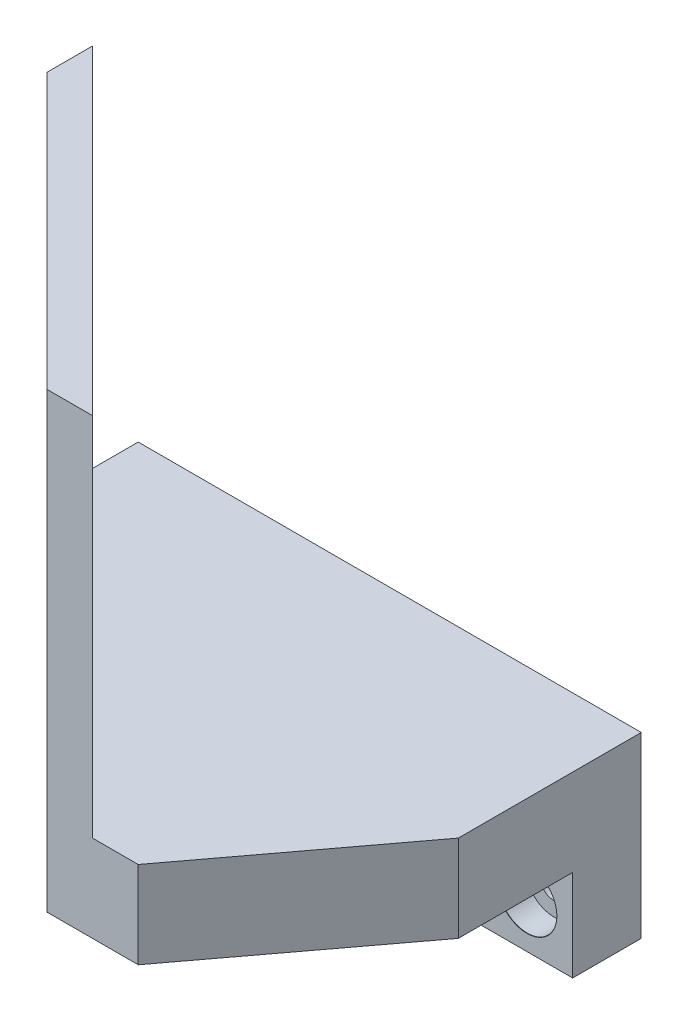
from build123d import *

# Parameters (mm, degrees)
SKETCH1_W                     = 40
SKETCH1_H                     = 10
BOSS_EXTRUDE1_DEPTH           = 7.5
CBORE_FOR_M3_SHCS1_AT_2_COUNT = 2
CBORE_FOR_M3_SHCS1_AT_2_PITCH = 30
SKETCH4_W                     = 55
SKETCH4_H                     = 9.5
BOSS_EXTRUDE2_DEPTH           = 40
BOSS_EXTRUDE3_DEPTH           = 40
CUT_EXTRUDE1_DEPTH            = 70.282032303
CUT_EXTRUDE2_DEPTH            = 70.282032303


# Read off the part's stored shape, not the designer's step: Ø5.1 (5.1) Diameter Hole1
with BuildPart() as part:
    # Sketch1 → Boss-Extrude1 (new body)
    with BuildSketch(Plane.XY):
        with Locations((20, -5)):
            Rectangle(SKETCH1_W, SKETCH1_H)
    extrude(amount=BOSS_EXTRUDE1_DEPTH)

    # Sketch3 → CBORE for M3 SHCS1 (revolve, cut)
    with BuildSketch(Plane(origin=(35, -5, 7.5), x_dir=(0, -1, 0), z_dir=(1, 0, 0))):
        Polygon((0, 0), (0, 7.5), (1.7, 7.5), (1.7, 3), (3.25, 3), (3.25, 0.025), (3.275, 0), align=None)
    cbore_for_m3_shcs1 = revolve(axis=Axis((35, -5, 13.85), (0, 0, -1)), mode=Mode.SUBTRACT)

    # CBORE for M3 SHCS1 at 2: CBORE for M3 SHCS1 ×2
    with Locations(*[(-i * CBORE_FOR_M3_SHCS1_AT_2_PITCH, 0, 0) for i in range(1, CBORE_FOR_M3_SHCS1_AT_2_COUNT)]):
        add(cbore_for_m3_shcs1, mode=Mode.SUBTRACT)

    # Sketch4 → Boss-Extrude2 (add)
    with BuildSketch(Plane.XY):
        with Locations((12.5, 4.75)):
            Rectangle(SKETCH4_W, SKETCH4_H)
    extrude(amount=BOSS_EXTRUDE2_DEPTH)

    # Sketch5 → Boss-Extrude3 (add)
    with BuildSketch(Plane(origin=(0, 9.5, 0), x_dir=(1, 0, 0), z_dir=(0, 1, 0))):
        Polygon((-15, -5), (20, -40), (15, -40), (-15, -10), align=None)
    extrude(amount=BOSS_EXTRUDE3_DEPTH)

    # Sketch7 → Cut-Extrude1 (cut, through all)
    with BuildSketch(Plane(origin=(0, 9.5, 0), x_dir=(1, 0, 0), z_dir=(0, 1, 0))):
        Polygon((15, -40), (-15, -10), (-15, -40), align=None)
    extrude(amount=-CUT_EXTRUDE1_DEPTH, mode=Mode.SUBTRACT)

    # Ø5.1 (5.1) Diameter Hole1 outline → Ø5.1 (5.1) Diameter Hole1 (revolve, cut)
    with BuildSketch(Plane(origin=(23.106601718, 29.5, 23.106601718), x_dir=(0.7071067811865471, 0, 0.707106781186548), z_dir=(0, 1, 0))):
        Polygon((2.55, -17.65266953), (2.55, -14.142135624), (0, -14.142135624), (0, -17.67766953), (2.575, -17.67766953), align=None)
    revolve(axis=Axis((23.106601718, 29.5, 23.106601718), (0.707106781186548, 0, -0.7071067811865471)), mode=Mode.SUBTRACT)

    # 5.1 _5.1_ Diameter Hole1 2 outline → 5.1 _5.1_ Diameter Hole1 2 (revolve, cut)
    with BuildSketch(Plane(origin=(1.893398282, 29.5, 1.893398282), x_dir=(0.7071067811865471, 0, 0.707106781186548), z_dir=(0, 1, 0))):
        Polygon((2.55, -17.65266953), (2.55, -14.142135624), (0, -14.142135624), (0, -17.67766953), (2.575, -17.67766953), align=None)
    revolve(axis=Axis((1.893398282, 29.5, 1.893398282), (0.707106781186548, 0, -0.7071067811865471)), mode=Mode.SUBTRACT)

    # Sketch11 → Cut-Extrude2 (cut, through all)
    with BuildSketch(Plane(origin=(0, 9.5, 0), x_dir=(1, 0, 0), z_dir=(0, 1, 0))):
        Polygon((40, -20), (25, -40), (40, -40), align=None)
    extrude(amount=-CUT_EXTRUDE2_DEPTH, mode=Mode.SUBTRACT)


solid = part.part
